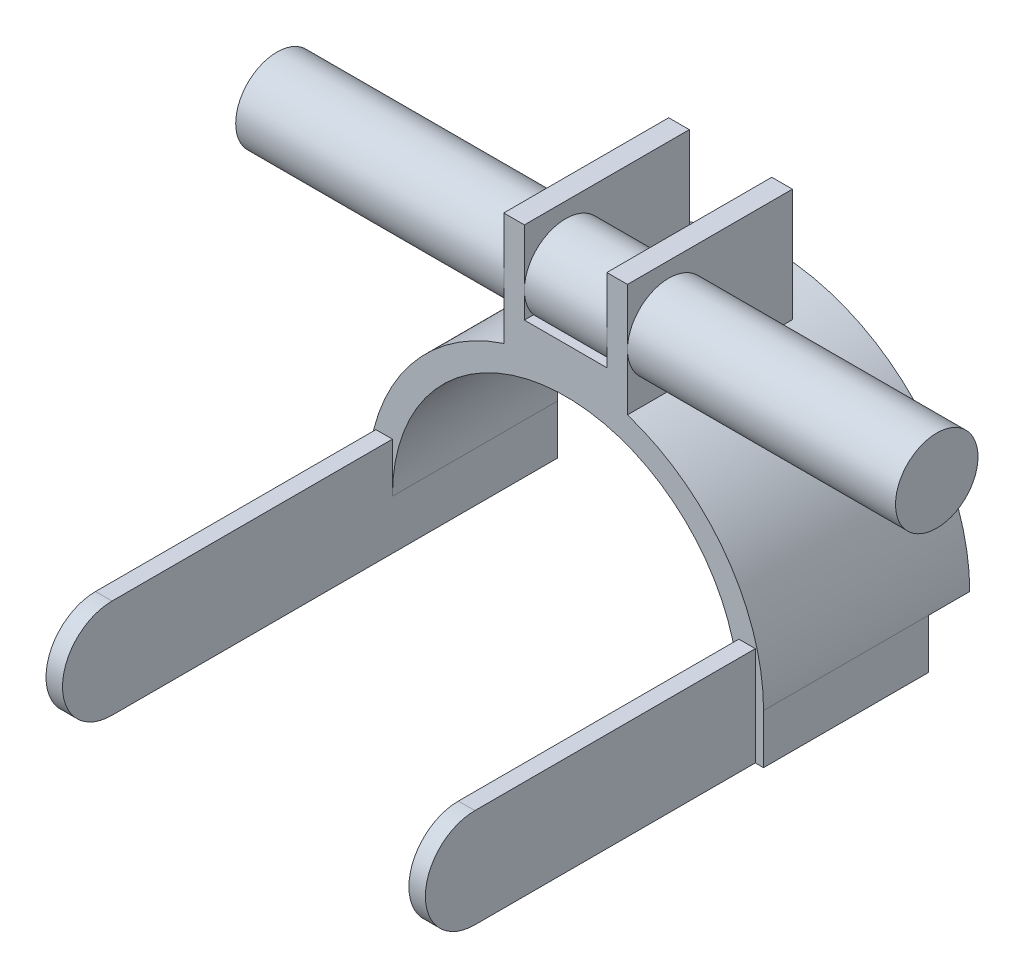
from build123d import *

# Parameters (mm, degrees)
EXTRUDE_1_DEPTH     = 10
EXTRUDE_2_DEPTH     = 40
EXTRUDE_4_DEPTH     = 40
SKETCH_7_W          = 4
SKETCH_7_H          = 24
EXTRUDE_5_DEPTH     = 120
CUT_EXTRUDE_3_DEPTH = 177.252659554
SKETCH_10_R         = 10
EXTRUDE_6_DEPTH     = 80


with BuildPart() as part:
    # 草图1 → 凸台-拉伸1 (new body)
    with BuildSketch(Plane.XY):
        with BuildLine():
            Line((-48, 0), (-46, 0))
            ThreePointArc((-46, 0), (0, 46), (46, 0))
            Line((46, 0), (48, 0))
            ThreePointArc((48, 0), (0, 48), (-48, 0))
        make_face()
    extrude(amount=EXTRUDE_1_DEPTH)

    # 草图2 → 凸台-拉伸2 (add)
    with BuildSketch(Plane.XY.offset(10)):
        with BuildLine():
            Line((-48, 0), (-48, -12))
            Line((-48, -12), (-46, -12))
            Line((-46, -12), (-46, 0))
            ThreePointArc((-46, 0), (0, 46), (46, 0))
            Line((46, 0), (46, -12))
            Line((46, -12), (48, -12))
            Line((48, -12), (48, 0))
            ThreePointArc((48, 0), (38.88444419, 28.142494559), (15, 45.596052461))
            Line((15, 45.596052461), (15, 73))
            Line((15, 73), (10, 73))
            Line((10, 73), (10, 53))
            Line((10, 53), (-10, 53))
            Line((-10, 53), (-10, 73))
            Line((-10, 73), (-15, 73))
            Line((-15, 73), (-15, 45.596052461))
            ThreePointArc((-15, 45.596052461), (-38.88444419, 28.142494559), (-48, 0))
        make_face()
    extrude(amount=EXTRUDE_2_DEPTH)

    # 草图6 → 凸台-拉伸4 (add)
    with BuildSketch(Plane(origin=(0, 0, 10), x_dir=(-1, 0, 0), z_dir=(0, 0, -1))):
        with BuildLine():
            Line((-46, 0), (-42.166380906, 0))
            Line((-42.166380906, 0), (-42, 0))
            ThreePointArc((-42, 0), (0, 42), (42, 0))
            Line((42, 0), (46, 0))
            ThreePointArc((46, 0), (0, 46), (-46, 0))
        make_face()
    extrude(amount=-EXTRUDE_4_DEPTH)

    # 草图7 → 凸台-拉伸5 (add)
    with BuildSketch(Plane(origin=(0, 0, 10), x_dir=(-1, 0, 0), z_dir=(0, 0, -1))):
        with Locations((-44, 0)):
            Rectangle(SKETCH_7_W, SKETCH_7_H)
        with Locations((44, 0)):
            Rectangle(SKETCH_7_W, SKETCH_7_H)
    extrude(amount=-EXTRUDE_5_DEPTH)

    # 草图8 → 切除-拉伸3 (cut, through all)
    with BuildSketch(Plane.ZY.offset(46)):
        with BuildLine():
            Line((118, 12), (136, 12))
            Line((136, 12), (136, -12))
            Line((136, -12), (118, -12))
            ThreePointArc((118, -12), (130, 0), (118, 12))
        make_face()
    extrude(amount=-CUT_EXTRUDE_3_DEPTH, mode=Mode.SUBTRACT)

    # 草图10 → 凸台-拉伸6 (add, symmetric)
    with BuildSketch(Plane(origin=(0, 0, 0), x_dir=(0, 0, -1), z_dir=(1, 0, 0))):
        with Locations((-40, 59.29802623)):
            Circle(SKETCH_10_R)
    extrude(amount=EXTRUDE_6_DEPTH, both=True)


solid = part.part
